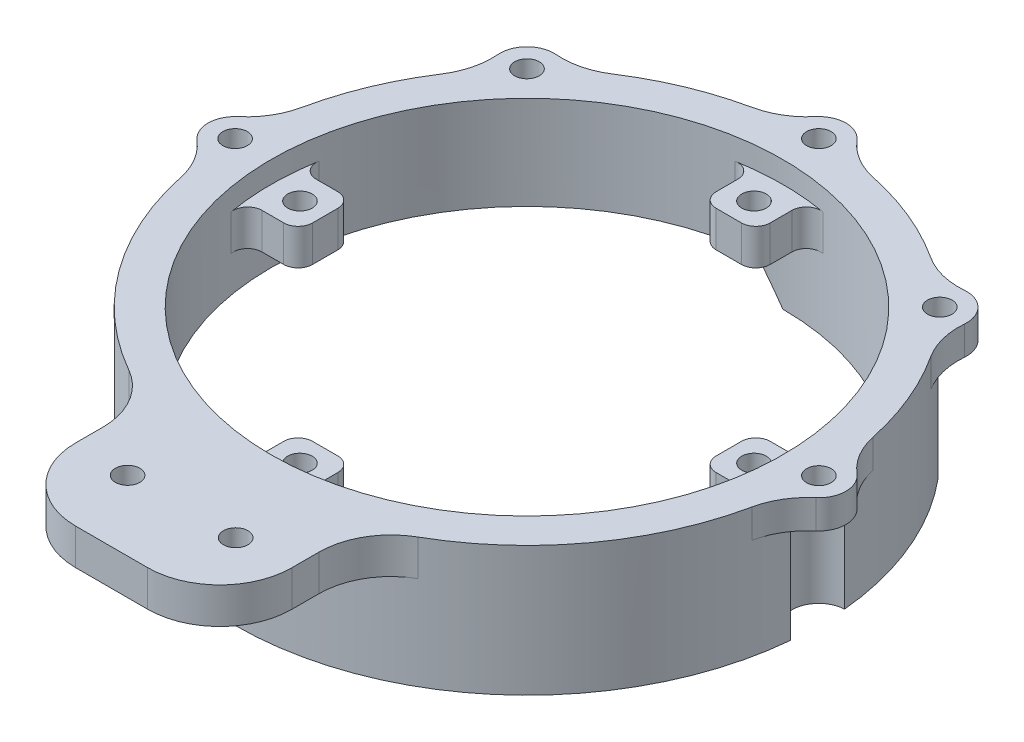
from build123d import *

# Parameters (mm, degrees)
CROQUIS1_R                                           = 40.5
CROQUIS1_R_2                                         = 35.5
SALIENTE_EXTRUIR1_DEPTH                              = 9
CROQUIS2_R                                           = 1.7
SALIENTE_EXTRUIR2_DEPTH                              = 5
REDONDEO1_R                                          = 10
CROQUIS4_R                                           = 1.7
SALIENTE_EXTRUIR3_DEPTH                              = 5
REDONDEO2_R                                          = 2
MATRIZC1_COUNT                                       = 4
REDONDEO2_OF_MATRIZC1_R                              = 2
REFRENTADO_PARA_TORNILLO_CON_CABEZA_PLAN_D           = 3.4
REFRENTADO_PARA_TORNILLO_CON_CABEZA_PLAN_CBORE_D     = 7.5
REFRENTADO_PARA_TORNILLO_CON_CABEZA_PLAN_CBORE_DEPTH = 14
CROQUIS8_R                                           = 3.75
CROQUIS8_R_2                                         = 1.7
SALIENTE_EXTRUIR4_DEPTH                              = 4
MATRIZC2_COUNT                                       = 3
MATRIZC2_ANGLE                                       = 90
SIMETR_A1_COPY_1_D                                   = 3.4
SIMETR_A1_COPY_1_CBORE_D                             = 7.5
SIMETR_A1_COPY_1_CBORE_DEPTH                         = 14
SIMETR_A1_COPY_2_D                                   = 3.4
SIMETR_A1_COPY_2_CBORE_D                             = 7.5
SIMETR_A1_COPY_2_CBORE_DEPTH                         = 14
SIMETR_A1_COPY_3_SKETCH_R                            = 3.75
SIMETR_A1_COPY_3_SKETCH_R_2                          = 1.7
SIMETR_A1_COPY_3_DEPTH                               = 4
SIMETR_A1_COPY_4_SKETCH_R                            = 3.75
SIMETR_A1_COPY_4_SKETCH_R_2                          = 1.7
SIMETR_A1_COPY_4_DEPTH                               = 4
SIMETR_A1_COPY_5_D                                   = 3.4
SIMETR_A1_COPY_5_CBORE_D                             = 7.5
SIMETR_A1_COPY_5_CBORE_DEPTH                         = 14
SIMETR_A1_COPY_6_SKETCH_R                            = 3.75
SIMETR_A1_COPY_6_SKETCH_R_2                          = 1.7
SIMETR_A1_COPY_6_DEPTH                               = 4
REDONDEO3_R                                          = 10
CORTAR_EXTRUIR2_START                                = -5
CORTAR_EXTRUIR2_DEPTH                                = 5
CHAFL_N2_SIZE2                                       = 5
CHAFL_N2_SIZE                                        = 3.501037691


# Some blends are built 0.0001 mm under size
with BuildPart() as part:
    # Croquis1 → Saliente-Extruir1 (new, symmetric)
    with BuildSketch(Plane(origin=(0, 0, 0), x_dir=(1, 0, 0), z_dir=(0, 1, 0))):
        with Locations(Location((0, 0, 0), (0, 0, 270))):
            Circle(CROQUIS1_R)
        with Locations(Location((0, 0, 0), (0, 0, 270))):
            Circle(CROQUIS1_R_2, mode=Mode.SUBTRACT)
    extrude(amount=SALIENTE_EXTRUIR1_DEPTH, both=True)

    # Croquis2 → Saliente-Extruir2 (add)
    with BuildSketch(Plane.XZ.offset(-9)):
        with BuildLine():
            Line((-15, 37.619808612), (-15, 57.619808612))
            Line((-15, 57.619808612), (15, 57.619808612))
            Line((15, 57.619808612), (15, 37.619808612))
            ThreePointArc((15, 37.619808612), (0, 40.5), (-15, 37.619808612))
        make_face()
        with Locations(Location((-7.5, 47.916594203, 0), (0, 0, 270))):
            Circle(CROQUIS2_R, mode=Mode.SUBTRACT)
        with Locations(Location((7.5, 47.916594203, 0), (0, 0, 90))):
            Circle(CROQUIS2_R, mode=Mode.SUBTRACT)
    extrude(amount=SALIENTE_EXTRUIR2_DEPTH)

    # Redondeo1
    redondeo1_edges = [part.edges().sort_by_distance(p)[0] for p in [
        (-15, 6.5, 37.619808612),
        (15, 6.5, 37.619808612),
        (15, 6.5, 57.619808612),
        (-15, 6.5, 57.619808612),
    ]]
    fillet(redondeo1_edges, radius=REDONDEO1_R)

    # Croquis4 → Saliente-Extruir3 (add)
    with BuildSketch(Plane(origin=(0, 1, 0), x_dir=(-1, 0, 0), z_dir=(0, -1, 0))):
        with BuildLine():
            Line((-3.75, -35.301380993), (-3.75, -28))
            Line((-3.75, -28), (3.75, -28))
            Line((3.75, -28), (3.75, -35.301380993))
            ThreePointArc((3.75, -35.301380993), (0, -35.5), (-3.75, -35.301380993))
        make_face()
        with Locations(Location((0, -31.5, 0), (0, 0, 90))):
            Circle(CROQUIS4_R, mode=Mode.SUBTRACT)
    saliente_extruir3 = extrude(amount=-SALIENTE_EXTRUIR3_DEPTH)

    # Redondeo2
    redondeo2_edges = [part.edges().sort_by_distance(p)[0] for p in [
        (-3.75, 3.5, 35.301380993),
        (3.75, 3.5, 35.301380993),
        (3.75, 3.5, 28),
        (-3.75, 3.5, 28),
    ]]
    fillet(redondeo2_edges, radius=REDONDEO2_R)

    # MatrizC1: Saliente-Extruir3 ×4 about axis
    matrizc1_axis = Axis((0, 0, 0), (0, 1, 0))
    for i in range(1, MATRIZC1_COUNT):
        add(saliente_extruir3.rotate(matrizc1_axis, i * 360 / MATRIZC1_COUNT))

    # Redondeo2 of MatrizC1
    redondeo2_of_matrizc1_edges = [part.edges().sort_by_distance(p)[0] for p in [
        (35.301380993, 3.5, 3.75),
        (35.301380993, 3.5, -3.75),
        (28, 3.5, -3.75),
        (28, 3.5, 3.75),
        (3.75, 3.5, -35.301380993),
        (-3.75, 3.5, -35.301380993),
        (-3.75, 3.5, -28),
        (3.75, 3.5, -28),
        (-35.301380993, 3.5, -3.75),
        (-35.301380993, 3.5, 3.75),
        (-28, 3.5, 3.75),
        (-28, 3.5, -3.75),
    ]]
    fillet(redondeo2_of_matrizc1_edges, radius=REDONDEO2_OF_MATRIZC1_R)

    # Refrentado para tornillo con cabeza plana de M31 (through all)
    with Locations(Plane(origin=(0, -9, 0), x_dir=(-1, 0, 0), z_dir=(0, -1, 0))):
        with Locations((0, 40.5)):
            refrentado_para_tornillo_con_cabeza_plan = CounterBoreHole(REFRENTADO_PARA_TORNILLO_CON_CABEZA_PLAN_D / 2, REFRENTADO_PARA_TORNILLO_CON_CABEZA_PLAN_CBORE_D / 2, REFRENTADO_PARA_TORNILLO_CON_CABEZA_PLAN_CBORE_DEPTH)

    # Croquis8 → Saliente-Extruir4 (add)
    with BuildSketch(Plane(origin=(0, 9, 0), x_dir=(1, 0, 0), z_dir=(0, 1, 0))):
        with Locations((0, 40.5)):
            Circle(CROQUIS8_R)
        with Locations(Location((0, 40.5, 0), (0, 0, 90))):
            Circle(CROQUIS8_R_2, mode=Mode.SUBTRACT)
    saliente_extruir4 = extrude(amount=-SALIENTE_EXTRUIR4_DEPTH)

    # MatrizC2: Refrentado para tornillo con cabeza plana de M31, Saliente-Extruir4 ×3 about axis
    matrizc2_axis = Axis((0, 0, 0), (0, 1, 0))
    add([refrentado_para_tornillo_con_cabeza_plan.rotate(matrizc2_axis, i * MATRIZC2_ANGLE / (MATRIZC2_COUNT - 1)) for i in range(1, MATRIZC2_COUNT)], mode=Mode.SUBTRACT)
    add([saliente_extruir4.rotate(matrizc2_axis, i * MATRIZC2_ANGLE / (MATRIZC2_COUNT - 1)) for i in range(1, MATRIZC2_COUNT)])

    # Simetría1 copy 1 (through all)
    with Locations(Plane(origin=(0, -9, 0), x_dir=(0.7071067811865462, 0, 0.7071067811865488), z_dir=(0, -1, 0))):
        with Locations((0, -40.5)):
            CounterBoreHole(SIMETR_A1_COPY_1_D / 2, SIMETR_A1_COPY_1_CBORE_D / 2, SIMETR_A1_COPY_1_CBORE_DEPTH)

    # Simetría1 copy 2 (through all)
    with Locations(Plane(origin=(0, -9, 0), x_dir=(0, 0, 1), z_dir=(0, -1, 0))):
        with Locations((0, -40.5)):
            CounterBoreHole(SIMETR_A1_COPY_2_D / 2, SIMETR_A1_COPY_2_CBORE_D / 2, SIMETR_A1_COPY_2_CBORE_DEPTH)

    # Simetría1 copy 3 sketch → Simetría1 copy 3 (add)
    with BuildSketch(Plane(origin=(0, 9, 0), x_dir=(-0.7071067811865462, 0, -0.7071067811865488), z_dir=(0, 1, 0))):
        with Locations((0, -40.5)):
            Circle(SIMETR_A1_COPY_3_SKETCH_R)
        with Locations((0, -40.5)):
            Circle(SIMETR_A1_COPY_3_SKETCH_R_2, mode=Mode.SUBTRACT)
    extrude(amount=-SIMETR_A1_COPY_3_DEPTH)

    # Simetría1 copy 4 sketch → Simetría1 copy 4 (add)
    with BuildSketch(Plane(origin=(0, 9, 0), x_dir=(0, 0, -1), z_dir=(0, 1, 0))):
        with Locations((0, -40.5)):
            Circle(SIMETR_A1_COPY_4_SKETCH_R)
        with Locations((0, -40.5)):
            Circle(SIMETR_A1_COPY_4_SKETCH_R_2, mode=Mode.SUBTRACT)
    extrude(amount=-SIMETR_A1_COPY_4_DEPTH)

    # Simetría1 copy 5 (through all)
    with Locations(Plane.XZ.offset(9)):
        with Locations((0, -40.5)):
            CounterBoreHole(SIMETR_A1_COPY_5_D / 2, SIMETR_A1_COPY_5_CBORE_D / 2, SIMETR_A1_COPY_5_CBORE_DEPTH)

    # Simetría1 copy 6 sketch → Simetría1 copy 6 (add)
    with BuildSketch(Plane(origin=(0, 9, 0), x_dir=(-1, 0, 0), z_dir=(0, 1, 0))):
        with Locations((0, -40.5)):
            Circle(SIMETR_A1_COPY_6_SKETCH_R)
        with Locations((0, -40.5)):
            Circle(SIMETR_A1_COPY_6_SKETCH_R_2, mode=Mode.SUBTRACT)
    extrude(amount=-SIMETR_A1_COPY_6_DEPTH)

    # Redondeo3
    # the kernel refuses this fillet: 10 mm, written as the material it adds along each edge
    with BuildSketch(Plane(origin=(3.745979069, 5, -40.326388889), x_dir=(-0.3229702045586981, 0, -0.9464091329690941), z_dir=(0, 1, 0)), Plane(origin=(-25.866255843, 5, -31.163870246), x_dir=(-0.8975867374639902, 0, -0.4408378939346639), z_dir=(0, 1, 0)), Plane(origin=(-40.326388889, 5, -3.745979069), x_dir=(-0.9464091329690931, 0, 0.3229702045587014), z_dir=(0, 1, 0)), Plane(origin=(31.163870246, 5, -25.866255843), x_dir=(0.4408378939346665, 0, -0.897586737463989), z_dir=(0, 1, 0)), Plane(origin=(40.326388889, 5, 3.745979069), x_dir=(0.9464091329690957, 0, -0.32297020455869396), z_dir=(0, 1, 0))) as redondeo3_piece_1:
        with BuildLine():
            CenterArc((6.412684914, -9.30442023), REDONDEO3_R, 111.496176577, 37.683075119)
            ThreePointArc((-2.175059251, -4.180881398), (-1.026664082, -2.122105354), (0, 0))
            ThreePointArc((0, 0), (1.374146767, -0.260842414), (2.748293534, 0))
        make_face()
    extrude(amount=4)
    with BuildSketch(Plane(origin=(-3.745979069, 5, -40.326388889), x_dir=(-0.9886449734760148, 0, 0.15027014480797551), z_dir=(0, 1, 0)), Plane(origin=(-31.163870246, 5, -25.866255843), x_dir=(-0.5928205265272785, 0, 0.80533460333449), z_dir=(0, 1, 0)), Plane(origin=(25.866255843, 5, -31.163870246), x_dir=(-0.8053346033344878, 0, -0.5928205265272815), z_dir=(0, 1, 0)), Plane(origin=(40.326388889, 5, -3.745979069), x_dir=(-0.15027014480797213, 0, -0.9886449734760153), z_dir=(0, 1, 0))) as redondeo3_piece_2:
        with BuildLine():
            CenterArc((5.294647205, -9.98305938), REDONDEO3_R, 93.33552043, 37.683075119)
            ThreePointArc((-1.268392176, -2.438093238), (-0.402794996, -1.339430586), (0, 0))
            ThreePointArc((0, 0), (2.356408921, -0.068609509), (4.712817842, 0))
        make_face()
    extrude(amount=4)
    with BuildSketch(Plane(origin=(-40.326388889, 5, 3.745979069), x_dir=(-0.9464091329690953, 0, -0.322970204558695), z_dir=(0, 1, 0))) as redondeo3_piece_3:
        with BuildLine():
            CenterArc((6.412684914, 9.30442023), REDONDEO3_R, 210.820748304, 37.683075119)
            ThreePointArc((-2.175059251, 4.180881398), (-1.026664082, 2.122105354), (0, 0))
            ThreePointArc((0, 0), (1.374146767, 0.260842414), (2.748293534, 0))
        make_face()
    extrude(amount=4)

    # Croquis10 → Cortar-Extruir2 (cut)
    with BuildSketch(Plane.XZ.offset(9).offset(CORTAR_EXTRUIR2_START)):
        with BuildLine():
            Line((0, 40.5), (0, 35.5))
            ThreePointArc((0, 35.5), (-35.5, 0), (0, -35.5))
            Line((0, -35.5), (0, -40.5))
            ThreePointArc((0, -40.5), (-40.5, 0), (0, 40.5))
        make_face()
    extrude(amount=CORTAR_EXTRUIR2_DEPTH, mode=Mode.SUBTRACT)

    # Chaflán2
    chafl_n2_edges = [part.edges().sort_by_distance(p)[0] for p in [
        (0, -4, -36.125),
    ]]
    chafl_n2_side = [part.faces().sort_by_distance(p)[0] for p in [
        (-0.070020754, -4, -36.125),
    ]]
    chamfer(chafl_n2_edges, length=CHAFL_N2_SIZE - 0.0001, length2=CHAFL_N2_SIZE2 - 0.0001, reference=chafl_n2_side[0])  # a hair under: the kernel refuses the full size
    # the kernel refuses this chamfer: 5, 3.501037691 mm, written as the material it adds along each edge
    with BuildSketch(Plane(origin=(0, -4, 53.412761151), x_dir=(-0.9989750717851554, 0.04526373771402081, 0), z_dir=(0, 0, -1))) as chafl_n2_2_piece_1_section:
        with BuildLine():
            Line((3.619462668, 0), (-0.348331978, -5.153345411))
            Line((-0.348331978, -5.153345411), (-0.448229485, -5.148819037))
            ThreePointArc((-0.448229485, -5.148819037), (-0.21676464, -2.574742553), (-0.099897507, 0.004526374))
            Line((-0.099897507, 0.004526374), (0.004526374, 0.099897507))
            ThreePointArc((0.004526374, 0.099897507), (1.810549919, 0.01806626), (3.623989042, 0.099897507))
            Line((3.623989042, 0.099897507), (3.619462668, 0))
        make_face()
    chafl_n2_2_piece_1 = extrude(amount=30.825522303, mode=Mode.PRIVATE)
    chafl_n2_2_piece_1 = chafl_n2_2_piece_1 - Plane(origin=(0, -5.656570303, 0), x_dir=(0, 0, 1), z_dir=(0, -1, 0)) * Cylinder(35.5, 83, mode=Mode.PRIVATE)
    chafl_n2_2_piece_1 = chafl_n2_2_piece_1 & Plane(origin=(0, -5.656570303, 0), x_dir=(0, 0, 1), z_dir=(0, 1, 0)) * Cylinder(40.5, 83, mode=Mode.PRIVATE)
    chafl_n2_2_piece_1 = split(chafl_n2_2_piece_1, bisect_by=Plane(origin=(-1.140213067, -9, 37.972268043), z_dir=(0, 1, 0)), keep=Keep.TOP, mode=Mode.PRIVATE)
    add(chafl_n2_2_piece_1)


solid = part.part
